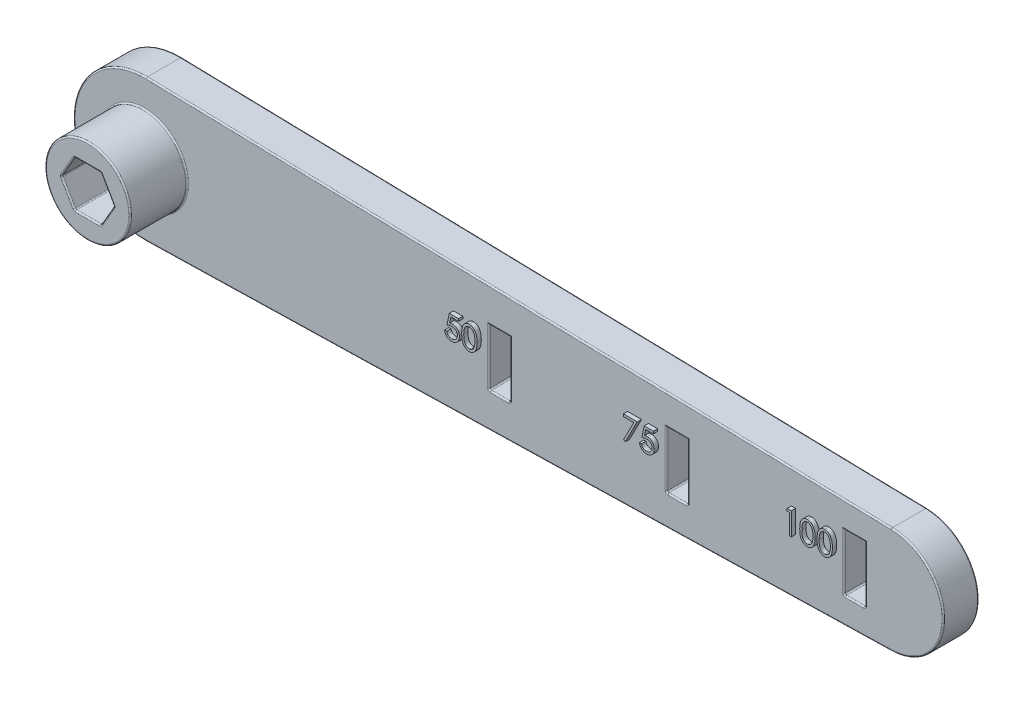
from build123d import *

# Parameters (mm, degrees)
BOSS_EXTRUDE1_DEPTH = 5
CUT_EXTRUDE2_REACH  = 115.054
CUT_EXTRUDE3_REACH  = 115.054
SKETCH4_W           = 3
SKETCH4_H           = 8
SKETCH6_R           = 6
BOSS_EXTRUDE3_DEPTH = 8
FILLET1_R           = 0.2
BOSS_EXTRUDE2_DEPTH = 0.6


with BuildPart() as part:
    # Sketch3 → Boss-Extrude1 (new body)
    with BuildSketch(Plane.XY):
        with BuildLine():
            Line((0.238095238, 9.997165131), (105.178571429, 7.497873848))
            ThreePointArc((105.178571429, 7.497873848), (112.5, 0), (105.178571429, -7.497873848))
            Line((105.178571429, -7.497873848), (0.238095238, -9.997165131))
            ThreePointArc((0.238095238, -9.997165131), (-10, 0), (0.238095238, 9.997165131))
        make_face()
    extrude(amount=BOSS_EXTRUDE1_DEPTH)

    # Sketch2 → Cut-Extrude2 (cut, up to next)
    with BuildSketch(Plane.XY, mode=Mode.PRIVATE) as cut_extrude2_sk1:
        Polygon((3.695041723, 0), (1.847520861, 3.2), (-1.847520861, 3.2), (-3.695041723, 0), (-1.847520861, -3.2), (1.847520861, -3.2), align=None)
    cut_extrude2_tool1 = extrude(cut_extrude2_sk1.sketch, amount=CUT_EXTRUDE2_REACH, mode=Mode.PRIVATE) & part.part
    add(cut_extrude2_tool1.solids().sort_by_distance((0, 0, 0))[0], mode=Mode.SUBTRACT)

    # Sketch4 → Cut-Extrude3 (cut, up to next)
    with BuildSketch(Plane.XY.offset(5), mode=Mode.PRIVATE) as cut_extrude3_sk1:
        with Locations((100, 0)):
            Rectangle(SKETCH4_W, SKETCH4_H)
    cut_extrude3_tool1 = extrude(cut_extrude3_sk1.sketch, amount=-CUT_EXTRUDE3_REACH, mode=Mode.PRIVATE) & part.part
    # Sketch4 → Cut-Extrude3 (cut, up to next)
    with BuildSketch(Plane.XY.offset(5), mode=Mode.PRIVATE) as cut_extrude3_sk2:
        with Locations((75, 0)):
            Rectangle(SKETCH4_W, SKETCH4_H)
    cut_extrude3_tool2 = extrude(cut_extrude3_sk2.sketch, amount=-CUT_EXTRUDE3_REACH, mode=Mode.PRIVATE) & part.part
    # Sketch4 → Cut-Extrude3 (cut, up to next)
    with BuildSketch(Plane.XY.offset(5), mode=Mode.PRIVATE) as cut_extrude3_sk3:
        with Locations((50, 0)):
            Rectangle(SKETCH4_W, SKETCH4_H)
    cut_extrude3_tool3 = extrude(cut_extrude3_sk3.sketch, amount=-CUT_EXTRUDE3_REACH, mode=Mode.PRIVATE) & part.part
    add(cut_extrude3_tool1.solids().sort_by_distance((100, 0, 5))[0], mode=Mode.SUBTRACT)
    add(cut_extrude3_tool2.solids().sort_by_distance((75, 0, 5))[0], mode=Mode.SUBTRACT)
    add(cut_extrude3_tool3.solids().sort_by_distance((50, 0, 5))[0], mode=Mode.SUBTRACT)

    # Sketch6 → Boss-Extrude3 (add)
    with BuildSketch(Plane.XY.offset(5)):
        Circle(SKETCH6_R)
        Polygon((3.695041723, 0), (1.847520861, 3.2), (-1.847520861, 3.2), (-3.695041723, 0), (-1.847520861, -3.2), (1.847520861, -3.2), align=None, mode=Mode.SUBTRACT)
    extrude(amount=BOSS_EXTRUDE3_DEPTH)

    # Fillet1
    fillet1_edges = [part.edges().sort_by_distance(p)[0] for p in [
        (51.5, -4, 2.5),
        (48.5, -4, 2.5),
        (101.5, -4, 2.5),
        (98.5, -4, 2.5),
        (76.5, -4, 2.5),
        (73.5, -4, 2.5),
        (76.5, 0, 0),
        (75, -4, 0),
        (73.5, 0, 0),
        (52.708333333, 8.74751949, 0),
        (51.5, 0, 0),
        (50, -4, 0),
        (48.5, 0, 0),
        (-10, 0, 0),
        (52.708333333, -8.74751949, 0),
        (112.5, 0, 0),
        (101.5, 0, 0),
        (100, -4, 0),
        (98.5, 0, 0),
        (100, -4, 5),
        (101.5, 0, 5),
        (52.708333333, 8.74751949, 5),
        (112.5, 0, 5),
        (52.708333333, -8.74751949, 5),
        (-10, 0, 5),
        (48.5, 0, 5),
        (50, -4, 5),
        (51.5, 0, 5),
        (73.5, 0, 5),
        (75, -4, 5),
        (76.5, 0, 5),
        (98.5, 0, 5),
        (-6, 0, 5),
        (-6, 0, 13),
        (50, 4, 0),
        (75, 4, 0),
        (100, 4, 0),
        (100, 4, 5),
        (75, 4, 5),
        (50, 4, 5),
        (0, -3.2, 0),
        (-2.771281292, -1.6, 0),
        (-2.771281292, 1.6, 0),
        (0, 3.2, 0),
        (2.771281292, 1.6, 0),
        (2.771281292, -1.6, 0),
        (2.771281292, 1.6, 13),
        (0, -3.2, 13),
        (-2.771281292, 1.6, 13),
        (3.695041723, 0, 6.5),
        (2.771281292, -1.6, 13),
        (1.847520861, -3.2, 6.5),
        (-1.847520861, 3.2, 6.5),
        (0, 3.2, 13),
        (1.847520861, 3.2, 6.5),
        (-1.847520861, -3.2, 6.5),
        (-2.771281292, -1.6, 13),
        (-3.695041723, 0, 6.5),
    ]]
    fillet(fillet1_edges, radius=FILLET1_R)

    # Sketch5 → Boss-Extrude2 (add)
    # profile 1 of 7: a face of its own
    with BuildSketch(Plane.XY.offset(5)):
        with BuildLine():
            Line((44.816666667, 3.175), (44.816666667, 2.849358974))
            Line((44.816666667, 2.849358974), (43.736708734, 2.849358974))
            Line((43.736708734, 2.849358974), (43.565619992, 2.014267829))
            add(Edge.make_bspline(
                [(43.565619992, 2.014267829), (43.599234964, 2.023548147), (43.664358655, 2.041527295), (43.760479386, 2.061489672), (43.851730885, 2.073523325), (43.910944971, 2.075166443), (43.939598357, 2.075961538)],
                knots=[0, 0, 0, 0, 1.100273476, 2.13160584, 3.095893838, 4, 4, 4, 4], degree=3))
            add(Edge.make_bspline(
                [(43.939598357, 2.075961538), (43.975052893, 2.075194154), (44.044765367, 2.073685284), (44.146763555, 2.059196535), (44.244129822, 2.036391041), (44.336660544, 2.004531711), (44.424526901, 1.963792167), (44.506920474, 1.912901507), (44.58507801, 1.853453414), (44.657597363, 1.785104724), (44.723387271, 1.709882972), (44.781232133, 1.629004046), (44.83036534, 1.543253952), (44.869881167, 1.4518134), (44.901435528, 1.355693311), (44.922437695, 1.253882325), (44.936422852, 1.147340102), (44.937985302, 1.074492385), (44.938782051, 1.037344752)],
                knots=[0, 0, 0, 0, 1.052922333, 2.070308379, 3.05430497, 4.020497103, 4.973039431, 5.925935799, 6.892292201, 7.88610001, 8.88166317, 9.857072816, 10.836096531, 11.812156883, 12.81219415, 13.836441305, 14.89672472, 16, 16, 16, 16], degree=3))
            add(Edge.make_bspline(
                [(44.938782051, 1.037344752), (44.938178733, 1.011471023), (44.93698025, 0.960073227), (44.930885531, 0.883742417), (44.919150989, 0.809027561), (44.903395982, 0.735918748), (44.882946788, 0.664554389), (44.858191718, 0.594730218), (44.82789675, 0.526880824), (44.79466686, 0.460364216), (44.757250412, 0.396684142), (44.715722766, 0.337131132), (44.671848356, 0.28081182), (44.624639385, 0.228330219), (44.573657054, 0.180031196), (44.519518798, 0.135628112), (44.462656617, 0.094370048), (44.40219079, 0.057931757), (44.339468681, 0.024401075), (44.273584512, -0.003106705), (44.20603802, -0.027699827), (44.135857025, -0.047302756), (44.063200495, -0.062663002), (43.987948663, -0.073095689), (43.910496198, -0.080694315), (43.857995294, -0.081169982), (43.831475361, -0.081410256)],
                knots=[0, 0, 0, 0, 1.056347294, 2.098418968, 3.122841568, 4.141288669, 5.149314143, 6.15115421, 7.162517403, 8.180376062, 9.185164535, 10.17417709, 11.141909838, 12.097768115, 13.052685741, 14.0056014, 14.954263652, 15.917497458, 16.885230207, 17.854509472, 18.828990115, 19.81800267, 20.826176721, 21.857883937, 22.917946725, 24, 24, 24, 24], degree=3))
            add(Edge.make_bspline(
                [(43.831475361, -0.081410256), (43.799839497, -0.080783568), (43.737599672, -0.079550632), (43.646413157, -0.066652434), (43.558679194, -0.048179453), (43.47510403, -0.02038798), (43.39493867, 0.014434781), (43.319262347, 0.058445879), (43.246141393, 0.10831978), (43.178548331, 0.167175529), (43.115813857, 0.231506183), (43.05965581, 0.301317758), (43.009641779, 0.375458038), (42.96657268, 0.454287077), (42.929835189, 0.537597745), (42.90097445, 0.625702181), (42.877680514, 0.718140042), (42.867825839, 0.781779298), (42.862820513, 0.814102564)],
                knots=[0, 0, 0, 0, 1.0467383, 2.05933395, 3.04377827, 4.011590433, 4.970194871, 5.932262533, 6.905835911, 7.896367577, 8.894135286, 9.877477877, 10.858688626, 11.851381753, 12.8477658, 13.868841284, 14.917554742, 16, 16, 16, 16], degree=3))
            Line((42.862820513, 0.814102564), (43.14775641, 0.814102564))
            add(Edge.make_bspline(
                [(43.14775641, 0.814102564), (43.154767316, 0.783825354), (43.168242666, 0.725630874), (43.197820738, 0.643868872), (43.233984782, 0.571007861), (43.276987298, 0.506084025), (43.328286254, 0.449470149), (43.386823665, 0.399017529), (43.452453385, 0.353501518), (43.525381529, 0.315562294), (43.602319108, 0.283205639), (43.682843649, 0.261659459), (43.764762592, 0.246509363), (43.820169399, 0.244992837), (43.848011819, 0.244230769)],
                knots=[0, 0, 0, 0, 1.136247022, 2.183929868, 3.172523383, 4.106158343, 5.02341133, 5.958108904, 6.928429099, 7.938127109, 8.96079061, 9.975095812, 10.982467395, 12, 12, 12, 12], degree=3))
            add(Edge.make_bspline(
                [(43.848011819, 0.244230769), (43.875188408, 0.244975332), (43.928699334, 0.246441382), (44.007449663, 0.257725343), (44.083479913, 0.275103997), (44.156039872, 0.301111651), (44.226399269, 0.332720789), (44.292778332, 0.37328375), (44.357097371, 0.419965339), (44.417357178, 0.473447424), (44.472547249, 0.532384219), (44.521311731, 0.59541014), (44.561930788, 0.662644708), (44.596161015, 0.732923925), (44.622153651, 0.807018045), (44.640696541, 0.884579825), (44.65158503, 0.965800843), (44.653082886, 1.021199431), (44.653846154, 1.049429087)],
                knots=[0, 0, 0, 0, 1.027316725, 2.022795036, 3.002884548, 3.971462791, 4.93288096, 5.914575861, 6.907176829, 7.935150275, 8.956128384, 9.956726525, 10.942570165, 11.921478529, 12.907843606, 13.90538589, 14.932640048, 16, 16, 16, 16], degree=3))
            add(Edge.make_bspline(
                [(44.653846154, 1.049429087), (44.653248819, 1.074897804), (44.652079621, 1.124749195), (44.642526889, 1.197682761), (44.625910778, 1.266691878), (44.602847687, 1.33210979), (44.573565563, 1.393998198), (44.537782122, 1.452420974), (44.494825825, 1.506608094), (44.445756755, 1.556584911), (44.392001246, 1.602708476), (44.332634423, 1.642027754), (44.268898632, 1.675105737), (44.201561781, 1.703651707), (44.129022195, 1.724153812), (44.052716392, 1.739546108), (43.971820379, 1.748450044), (43.916511254, 1.749685471), (43.888080929, 1.750320513)],
                knots=[0, 0, 0, 0, 1.045622112, 2.046656509, 3.013763289, 3.955457236, 4.890082067, 5.820317437, 6.762574623, 7.722996705, 8.69280354, 9.665887285, 10.63943826, 11.638615906, 12.663482002, 13.728887084, 14.832589034, 16, 16, 16, 16], degree=3))
            add(Edge.make_bspline(
                [(43.888080929, 1.750320513), (43.863471115, 1.749793834), (43.812658093, 1.748706375), (43.734713815, 1.740699481), (43.652806323, 1.727782407), (43.567249602, 1.710014883), (43.477786713, 1.686763834), (43.384606449, 1.658901395), (43.287512893, 1.625589296), (43.222091814, 1.600432216), (43.188461538, 1.5875)],
                knots=[0, 0, 0, 0, 0.817624296, 1.688186739, 2.600797293, 3.572016777, 4.590301741, 5.671205678, 6.80286297, 8, 8, 8, 8], degree=3))
            Line((43.188461538, 1.5875), (43.514102564, 3.175))
            Line((43.514102564, 3.175), (44.816666667, 3.175))
        make_face()
    # profile 2 of 7: a face of its own
    with BuildSketch(Plane.XY.offset(5)):
        with BuildLine():
            add(Edge.make_bspline(
                [(45.264423077, 1.586227965), (45.264720636, 1.637116309), (45.26529865, 1.735967652), (45.27172886, 1.880008006), (45.282410778, 2.015136268), (45.29704968, 2.141358907), (45.314864134, 2.258708507), (45.338645325, 2.366871466), (45.365689796, 2.466348394), (45.3970338, 2.557463681), (45.432401295, 2.641444883), (45.470895231, 2.719844887), (45.514043295, 2.792545069), (45.559379494, 2.860705779), (45.608739016, 2.923211273), (45.660717205, 2.98094426), (45.717342764, 3.032570441), (45.776690779, 3.079602444), (45.839298571, 3.120831607), (45.903381561, 3.15714702), (45.969380836, 3.188171185), (46.037476588, 3.212564652), (46.107056765, 3.232713063), (46.178364604, 3.246491609), (46.251517842, 3.25516109), (46.300894929, 3.255989917), (46.325936498, 3.256410256)],
                knots=[0, 0, 0, 0, 1.646270934, 3.197905019, 4.663502075, 6.030701355, 7.308322542, 8.50163776, 9.611534131, 10.641858119, 11.616356847, 12.558055219, 13.465016945, 14.349605745, 15.204443733, 16.039544428, 16.859896111, 17.680448484, 18.487036065, 19.28249412, 20.06191084, 20.843045899, 21.620316918, 22.403196591, 23.190181807, 24, 24, 24, 24], degree=3))
            add(Edge.make_bspline(
                [(46.325936498, 3.256410256), (46.351187254, 3.255967738), (46.401403062, 3.255087709), (46.475643974, 3.246629561), (46.548169756, 3.232595043), (46.618671211, 3.212709587), (46.687727449, 3.188039223), (46.754798333, 3.157117338), (46.820300471, 3.121122937), (46.883192946, 3.07882842), (46.944166204, 3.031673069), (47.001722571, 2.978366934), (47.055867284, 2.91944826), (47.107279883, 2.855547427), (47.154501746, 2.785438814), (47.199471931, 2.7103418), (47.239723706, 2.628943087), (47.278490162, 2.542600805), (47.311951928, 2.448925915), (47.342129165, 2.348446454), (47.366512229, 2.239975584), (47.386822498, 2.124082419), (47.402556796, 2.000341345), (47.414016407, 1.869017616), (47.420069849, 1.730024833), (47.421209856, 1.634994498), (47.421794872, 1.586227965)],
                knots=[0, 0, 0, 0, 0.810914788, 1.612654377, 2.396697861, 3.181598691, 3.963628158, 4.749916497, 5.551656086, 6.361998678, 7.18212741, 8.025565596, 8.878627764, 9.750805457, 10.657531673, 11.591944965, 12.560506719, 13.57287815, 14.630710178, 15.753379473, 16.941251878, 18.199788006, 19.531962791, 20.947069417, 22.433333509, 24, 24, 24, 24], degree=3))
            add(Edge.make_bspline(
                [(47.421794872, 1.586227965), (47.421203792, 1.537674134), (47.420052096, 1.443068975), (47.414084269, 1.30470159), (47.402328939, 1.174074794), (47.387624164, 1.050875303), (47.367257933, 0.935615891), (47.342216104, 0.827897713), (47.314411883, 0.727255591), (47.280090319, 0.634514012), (47.242524889, 0.548379235), (47.20165339, 0.467945464), (47.157865762, 0.392501756), (47.110160258, 0.322651986), (47.059311804, 0.257901347), (47.004232096, 0.199392789), (46.946473779, 0.145716537), (46.885321088, 0.097953989), (46.821447752, 0.056148487), (46.756170589, 0.018761637), (46.688331377, -0.011385165), (46.619467484, -0.037270523), (46.548593895, -0.057046647), (46.475798955, -0.070720788), (46.401452941, -0.080310965), (46.351195807, -0.081042557), (46.325936498, -0.081410256)],
                knots=[0, 0, 0, 0, 1.561518951, 3.042555995, 4.452378317, 5.7783523, 7.031515105, 8.214008947, 9.334062868, 10.386615937, 11.391082383, 12.354592575, 13.286541444, 14.194233754, 15.072674879, 15.931287219, 16.775624067, 17.606195743, 18.42308326, 19.229000347, 20.022332153, 20.807536673, 21.593273796, 22.3848459, 23.188221202, 24, 24, 24, 24], degree=3))
            add(Edge.make_bspline(
                [(46.325936498, -0.081410256), (46.300895624, -0.080987205), (46.251519906, -0.080153031), (46.178356634, -0.071522718), (46.107343275, -0.057647511), (46.038129405, -0.038219592), (45.970359924, -0.01443899), (45.904958292, 0.01654328), (45.841197322, 0.052224899), (45.779247125, 0.092860746), (45.720271807, 0.139416844), (45.663939501, 0.190910163), (45.611665377, 0.248625686), (45.56301159, 0.311652088), (45.51677081, 0.379409529), (45.47423545, 0.452823125), (45.434891889, 0.531601779), (45.39892958, 0.616254455), (45.367044721, 0.708016425), (45.338880014, 0.807937466), (45.316642171, 0.916899507), (45.297607633, 1.034027404), (45.2822548, 1.15982447), (45.271773376, 1.294358997), (45.265295184, 1.437547151), (45.264719084, 1.535763303), (45.264423077, 1.586227965)],
                knots=[0, 0, 0, 0, 0.810891512, 1.598919785, 2.382837074, 3.152667961, 3.926044502, 4.706494248, 5.493654104, 6.291793342, 7.103789334, 7.925228297, 8.761435821, 9.622817696, 10.50288917, 11.416980706, 12.369136599, 13.353924996, 14.394355917, 15.514179734, 16.714354668, 17.994756427, 19.357759367, 20.818452758, 22.365282078, 24, 24, 24, 24], degree=3))
        make_face()
        with BuildLine():
            add(Edge.make_bspline(
                [(45.549358974, 1.5875), (45.54946733, 1.545092252), (45.549677627, 1.46278714), (45.555171466, 1.343186467), (45.562655605, 1.231634812), (45.572308782, 1.127990532), (45.586644313, 1.03260445), (45.6027069, 0.944820523), (45.622254095, 0.865103315), (45.645381719, 0.792905801), (45.671724328, 0.727002717), (45.700486076, 0.665678758), (45.731384017, 0.608209501), (45.765963532, 0.555111156), (45.803623625, 0.506210565), (45.843513653, 0.46064221), (45.887122355, 0.420004948), (45.94745075, 0.371267015), (46.027094694, 0.32090323), (46.12744325, 0.27704642), (46.230556774, 0.249485191), (46.300543979, 0.245980213), (46.335476763, 0.244230769)],
                knots=[0, 0, 0, 0, 1.459021318, 2.831673884, 4.118529203, 5.306027144, 6.411944654, 7.436330062, 8.375795394, 9.233974572, 10.042671642, 10.816086306, 11.563610507, 12.285937304, 12.993564865, 13.685989202, 14.367179055, 15.041617293, 16.353048772, 17.594441528, 18.799311195, 20, 20, 20, 20], degree=3))
            add(Edge.make_bspline(
                [(46.335476763, 0.244230769), (46.370635508, 0.245680185), (46.440880408, 0.248576023), (46.543508922, 0.276514878), (46.643140667, 0.318669388), (46.721220213, 0.368514626), (46.780622235, 0.415983896), (46.823182647, 0.456455755), (46.862246077, 0.501772864), (46.899295673, 0.550667225), (46.933276406, 0.604072978), (46.964176538, 0.661733315), (46.992373575, 0.723808354), (47.00843821, 0.767142332), (47.016651643, 0.789297877)],
                knots=[0, 0, 0, 0, 1.353760809, 2.704726607, 4.075137775, 5.516104923, 6.260822281, 7.007110065, 7.778089737, 8.566572457, 9.372053459, 10.217411131, 11.088608312, 12, 12, 12, 12], degree=3))
            add(Edge.make_bspline(
                [(47.016651643, 0.789297877), (47.026223603, 0.817627712), (47.045658789, 0.875149426), (47.070706613, 0.964379311), (47.090432796, 1.057998961), (47.108179564, 1.155448888), (47.120292693, 1.25744776), (47.130042495, 1.36367998), (47.135785332, 1.474225644), (47.136497214, 1.549332529), (47.136858974, 1.5875)],
                knots=[0, 0, 0, 0, 0.884706709, 1.796334032, 2.740027952, 3.714592787, 4.726048262, 5.777819803, 6.87074269, 8, 8, 8, 8], degree=3))
            add(Edge.make_bspline(
                [(47.136858974, 1.5875), (47.136359874, 1.625661298), (47.135383527, 1.700312955), (47.131651553, 1.809640161), (47.122014453, 1.913478773), (47.111310967, 2.01227613), (47.095529202, 2.105485333), (47.078513191, 2.193886682), (47.055652092, 2.276384997), (47.03123201, 2.354271903), (47.00328258, 2.426662497), (46.972516164, 2.493894289), (46.939657854, 2.556291861), (46.903968822, 2.613684015), (46.865872738, 2.666327822), (46.824364104, 2.713167775), (46.781089423, 2.755655596), (46.72047669, 2.804153784), (46.641125013, 2.853603679), (46.542386461, 2.89911119), (46.439633805, 2.925244427), (46.370170743, 2.928928957), (46.335476763, 2.930769231)],
                knots=[0, 0, 0, 0, 1.31362396, 2.569729283, 3.763502607, 4.902122613, 5.988968491, 7.01645872, 7.998833611, 8.933434873, 9.825090667, 10.667526885, 11.477055099, 12.250526234, 12.991942729, 13.710640831, 14.402115721, 15.076753259, 16.378508321, 17.609869233, 18.806226677, 20, 20, 20, 20], degree=3))
            add(Edge.make_bspline(
                [(46.335476763, 2.930769231), (46.300360726, 2.928926418), (46.230064678, 2.925237437), (46.126244034, 2.899208557), (46.026726515, 2.853839652), (45.947584674, 2.80399), (45.886929667, 2.756511674), (45.844218938, 2.715339677), (45.804172053, 2.670303432), (45.76728064, 2.620953123), (45.732728219, 2.567916683), (45.700995443, 2.510776875), (45.672404722, 2.449244137), (45.646020893, 2.383370657), (45.622822721, 2.311179371), (45.603687483, 2.231560356), (45.586009942, 2.144055639), (45.573495662, 2.048152943), (45.562370684, 1.944482704), (45.555221175, 1.832652565), (45.549659249, 1.712851306), (45.549461071, 1.630120641), (45.549358974, 1.5875)],
                knots=[0, 0, 0, 0, 1.207732386, 2.417664972, 3.655092373, 4.956220595, 5.625982001, 6.301752483, 6.994047911, 7.697131622, 8.419323945, 9.170223765, 9.943494443, 10.752040957, 11.610060368, 12.549350801, 13.567764191, 14.679664412, 15.874934091, 17.154273443, 18.533957287, 20, 20, 20, 20], degree=3))
        make_face(mode=Mode.SUBTRACT)
    # profile 3 of 7: a face of its own
    with BuildSketch(Plane.XY.offset(5)):
        Polygon((68.025641026, 3.175), (69.979487179, 3.175), (68.310576923, -0.081410256), (68.064438101, 0.054061498), (69.497385817, 2.849358974), (68.025641026, 2.849358974), align=None)
    # profile 4 of 7: a face of its own
    with BuildSketch(Plane.XY.offset(5)):
        with BuildLine():
            Line((72.258974359, 3.175), (72.258974359, 2.849358974))
            Line((72.258974359, 2.849358974), (71.179016426, 2.849358974))
            Line((71.179016426, 2.849358974), (71.007927684, 2.014267829))
            add(Edge.make_bspline(
                [(71.007927684, 2.014267829), (71.041542656, 2.023548147), (71.106666347, 2.041527295), (71.202787078, 2.061489672), (71.294038577, 2.073523325), (71.353252663, 2.075166443), (71.38190605, 2.075961538)],
                knots=[0, 0, 0, 0, 1.100273476, 2.13160584, 3.095893838, 4, 4, 4, 4], degree=3))
            add(Edge.make_bspline(
                [(71.38190605, 2.075961538), (71.417360585, 2.075194154), (71.48707306, 2.073685284), (71.589071247, 2.059196535), (71.686437515, 2.036391041), (71.778968236, 2.004531711), (71.866834593, 1.963792167), (71.949228167, 1.912901507), (72.027385702, 1.853453414), (72.099905055, 1.785104724), (72.165694963, 1.709882972), (72.223539825, 1.629004046), (72.272673032, 1.543253952), (72.31218886, 1.4518134), (72.34374322, 1.355693311), (72.364745387, 1.253882325), (72.378730544, 1.147340102), (72.380292995, 1.074492385), (72.381089744, 1.037344752)],
                knots=[0, 0, 0, 0, 1.052922333, 2.070308379, 3.05430497, 4.020497103, 4.973039431, 5.925935799, 6.892292201, 7.88610001, 8.88166317, 9.857072816, 10.836096531, 11.812156883, 12.81219415, 13.836441305, 14.89672472, 16, 16, 16, 16], degree=3))
            add(Edge.make_bspline(
                [(72.381089744, 1.037344752), (72.380486425, 1.011471023), (72.379287942, 0.960073227), (72.373193223, 0.883742417), (72.361458681, 0.809027561), (72.345703674, 0.735918748), (72.325254481, 0.664554389), (72.30049941, 0.594730218), (72.270204442, 0.526880824), (72.236974552, 0.460364216), (72.199558104, 0.396684142), (72.158030458, 0.337131132), (72.114156048, 0.28081182), (72.066947077, 0.228330219), (72.015964746, 0.180031196), (71.96182649, 0.135628112), (71.904964309, 0.094370048), (71.844498482, 0.057931757), (71.781776373, 0.024401075), (71.715892204, -0.003106705), (71.648345712, -0.027699827), (71.578164718, -0.047302756), (71.505508188, -0.062663002), (71.430256356, -0.073095689), (71.352803891, -0.080694315), (71.300302986, -0.081169982), (71.273783053, -0.081410256)],
                knots=[0, 0, 0, 0, 1.056347294, 2.098418968, 3.122841568, 4.141288669, 5.149314143, 6.15115421, 7.162517403, 8.180376062, 9.185164535, 10.17417709, 11.141909838, 12.097768115, 13.052685741, 14.0056014, 14.954263652, 15.917497458, 16.885230207, 17.854509472, 18.828990115, 19.81800267, 20.826176721, 21.857883937, 22.917946725, 24, 24, 24, 24], degree=3))
            add(Edge.make_bspline(
                [(71.273783053, -0.081410256), (71.242147189, -0.080783568), (71.179907364, -0.079550632), (71.08872085, -0.066652434), (71.000986886, -0.048179453), (70.917411723, -0.02038798), (70.837246362, 0.014434781), (70.761570039, 0.058445879), (70.688449085, 0.10831978), (70.620856024, 0.167175529), (70.558121549, 0.231506183), (70.501963502, 0.301317758), (70.451949471, 0.375458038), (70.408880372, 0.454287077), (70.372142882, 0.537597745), (70.343282142, 0.625702181), (70.319988206, 0.718140042), (70.310133532, 0.781779298), (70.305128205, 0.814102564)],
                knots=[0, 0, 0, 0, 1.0467383, 2.05933395, 3.04377827, 4.011590433, 4.970194871, 5.932262533, 6.905835911, 7.896367577, 8.894135286, 9.877477877, 10.858688626, 11.851381753, 12.8477658, 13.868841284, 14.917554742, 16, 16, 16, 16], degree=3))
            Line((70.305128205, 0.814102564), (70.590064103, 0.814102564))
            add(Edge.make_bspline(
                [(70.590064103, 0.814102564), (70.597075008, 0.783825354), (70.610550358, 0.725630874), (70.64012843, 0.643868872), (70.676292474, 0.571007861), (70.71929499, 0.506084025), (70.770593947, 0.449470149), (70.829131357, 0.399017529), (70.894761078, 0.353501518), (70.967689221, 0.315562294), (71.044626801, 0.283205639), (71.125151341, 0.261659459), (71.207070284, 0.246509363), (71.262477091, 0.244992837), (71.290319511, 0.244230769)],
                knots=[0, 0, 0, 0, 1.136247022, 2.183929868, 3.172523383, 4.106158343, 5.02341133, 5.958108904, 6.928429099, 7.938127109, 8.96079061, 9.975095812, 10.982467395, 12, 12, 12, 12], degree=3))
            add(Edge.make_bspline(
                [(71.290319511, 0.244230769), (71.3174961, 0.244975332), (71.371007026, 0.246441382), (71.449757355, 0.257725343), (71.525787605, 0.275103997), (71.598347565, 0.301111651), (71.668706961, 0.332720789), (71.735086025, 0.37328375), (71.799405063, 0.419965339), (71.85966487, 0.473447424), (71.914854942, 0.532384219), (71.963619423, 0.59541014), (72.00423848, 0.662644708), (72.038468708, 0.732923925), (72.064461343, 0.807018045), (72.083004233, 0.884579825), (72.093892722, 0.965800843), (72.095390578, 1.021199431), (72.096153846, 1.049429087)],
                knots=[0, 0, 0, 0, 1.027316725, 2.022795036, 3.002884548, 3.971462791, 4.93288096, 5.914575861, 6.907176829, 7.935150275, 8.956128384, 9.956726525, 10.942570165, 11.921478529, 12.907843606, 13.90538589, 14.932640048, 16, 16, 16, 16], degree=3))
            add(Edge.make_bspline(
                [(72.096153846, 1.049429087), (72.095556511, 1.074897804), (72.094387313, 1.124749195), (72.084834581, 1.197682761), (72.068218471, 1.266691878), (72.04515538, 1.33210979), (72.015873255, 1.393998198), (71.980089814, 1.452420974), (71.937133518, 1.506608094), (71.888064447, 1.556584911), (71.834308939, 1.602708476), (71.774942115, 1.642027754), (71.711206324, 1.675105737), (71.643869473, 1.703651707), (71.571329887, 1.724153812), (71.495024085, 1.739546108), (71.414128071, 1.748450044), (71.358818947, 1.749685471), (71.330388622, 1.750320513)],
                knots=[0, 0, 0, 0, 1.045622112, 2.046656509, 3.013763289, 3.955457236, 4.890082067, 5.820317437, 6.762574623, 7.722996705, 8.69280354, 9.665887285, 10.63943826, 11.638615906, 12.663482002, 13.728887084, 14.832589034, 16, 16, 16, 16], degree=3))
            add(Edge.make_bspline(
                [(71.330388622, 1.750320513), (71.305778808, 1.749793834), (71.254965785, 1.748706375), (71.177021507, 1.740699481), (71.095114015, 1.727782407), (71.009557294, 1.710014883), (70.920094405, 1.686763834), (70.826914141, 1.658901395), (70.729820585, 1.625589296), (70.664399507, 1.600432216), (70.630769231, 1.5875)],
                knots=[0, 0, 0, 0, 0.817624296, 1.688186739, 2.600797293, 3.572016777, 4.590301741, 5.671205678, 6.80286297, 8, 8, 8, 8], degree=3))
            Line((70.630769231, 1.5875), (70.956410256, 3.175))
            Line((70.956410256, 3.175), (72.258974359, 3.175))
        make_face()
    # profile 5 of 7: a face of its own
    with BuildSketch(Plane.XY.offset(5)):
        Polygon((91.096930088, 3.175), (91.683974359, 3.175), (91.683974359, 0), (91.399038462, 0), (91.399038462, 2.849358974), (90.910576923, 2.849358974), align=None)
    # profile 6 of 7: a face of its own
    with BuildSketch(Plane.XY.offset(5)):
        with BuildLine():
            add(Edge.make_bspline(
                [(92.864423077, 1.586227965), (92.864720636, 1.637116309), (92.86529865, 1.735967652), (92.87172886, 1.880008006), (92.882410778, 2.015136268), (92.89704968, 2.141358907), (92.914864134, 2.258708507), (92.938645325, 2.366871466), (92.965689796, 2.466348394), (92.9970338, 2.557463681), (93.032401295, 2.641444883), (93.070895231, 2.719844887), (93.114043295, 2.792545069), (93.159379494, 2.860705779), (93.208739016, 2.923211273), (93.260717205, 2.98094426), (93.317342764, 3.032570441), (93.376690779, 3.079602444), (93.439298571, 3.120831607), (93.503381561, 3.15714702), (93.569380836, 3.188171185), (93.637476588, 3.212564652), (93.707056765, 3.232713063), (93.778364604, 3.246491609), (93.851517842, 3.25516109), (93.900894929, 3.255989917), (93.925936498, 3.256410256)],
                knots=[0, 0, 0, 0, 1.646270934, 3.197905019, 4.663502075, 6.030701355, 7.308322542, 8.50163776, 9.611534131, 10.641858119, 11.616356847, 12.558055219, 13.465016945, 14.349605745, 15.204443733, 16.039544428, 16.859896111, 17.680448484, 18.487036065, 19.28249412, 20.06191084, 20.843045899, 21.620316918, 22.403196591, 23.190181807, 24, 24, 24, 24], degree=3))
            add(Edge.make_bspline(
                [(93.925936498, 3.256410256), (93.951187254, 3.255967738), (94.001403062, 3.255087709), (94.075643974, 3.246629561), (94.148169756, 3.232595043), (94.218671211, 3.212709587), (94.287727449, 3.188039223), (94.354798333, 3.157117338), (94.420300471, 3.121122937), (94.483192946, 3.07882842), (94.544166204, 3.031673069), (94.601722571, 2.978366934), (94.655867284, 2.91944826), (94.707279883, 2.855547427), (94.754501746, 2.785438814), (94.799471931, 2.7103418), (94.839723706, 2.628943087), (94.878490162, 2.542600805), (94.911951928, 2.448925915), (94.942129165, 2.348446454), (94.966512229, 2.239975584), (94.986822498, 2.124082419), (95.002556796, 2.000341345), (95.014016407, 1.869017616), (95.020069849, 1.730024833), (95.021209856, 1.634994498), (95.021794872, 1.586227965)],
                knots=[0, 0, 0, 0, 0.810914788, 1.612654377, 2.396697861, 3.181598691, 3.963628158, 4.749916497, 5.551656086, 6.361998678, 7.18212741, 8.025565596, 8.878627764, 9.750805457, 10.657531673, 11.591944965, 12.560506719, 13.57287815, 14.630710178, 15.753379473, 16.941251878, 18.199788006, 19.531962791, 20.947069417, 22.433333509, 24, 24, 24, 24], degree=3))
            add(Edge.make_bspline(
                [(95.021794872, 1.586227965), (95.021203792, 1.537674134), (95.020052096, 1.443068975), (95.014084269, 1.30470159), (95.002328939, 1.174074794), (94.987624164, 1.050875303), (94.967257933, 0.935615891), (94.942216104, 0.827897713), (94.914411883, 0.727255591), (94.880090319, 0.634514012), (94.842524889, 0.548379235), (94.80165339, 0.467945464), (94.757865762, 0.392501756), (94.710160258, 0.322651986), (94.659311804, 0.257901347), (94.604232096, 0.199392789), (94.546473779, 0.145716537), (94.485321088, 0.097953989), (94.421447752, 0.056148487), (94.356170589, 0.018761637), (94.288331377, -0.011385165), (94.219467484, -0.037270523), (94.148593895, -0.057046647), (94.075798955, -0.070720788), (94.001452941, -0.080310965), (93.951195807, -0.081042557), (93.925936498, -0.081410256)],
                knots=[0, 0, 0, 0, 1.561518951, 3.042555995, 4.452378317, 5.7783523, 7.031515105, 8.214008947, 9.334062868, 10.386615937, 11.391082383, 12.354592575, 13.286541444, 14.194233754, 15.072674879, 15.931287219, 16.775624067, 17.606195743, 18.42308326, 19.229000347, 20.022332153, 20.807536673, 21.593273796, 22.3848459, 23.188221202, 24, 24, 24, 24], degree=3))
            add(Edge.make_bspline(
                [(93.925936498, -0.081410256), (93.900895624, -0.080987205), (93.851519906, -0.080153031), (93.778356634, -0.071522718), (93.707343275, -0.057647511), (93.638129405, -0.038219592), (93.570359924, -0.01443899), (93.504958292, 0.01654328), (93.441197322, 0.052224899), (93.379247125, 0.092860746), (93.320271807, 0.139416844), (93.263939501, 0.190910163), (93.211665377, 0.248625686), (93.16301159, 0.311652088), (93.11677081, 0.379409529), (93.07423545, 0.452823125), (93.034891889, 0.531601779), (92.99892958, 0.616254455), (92.967044721, 0.708016425), (92.938880014, 0.807937466), (92.916642171, 0.916899507), (92.897607633, 1.034027404), (92.8822548, 1.15982447), (92.871773376, 1.294358997), (92.865295184, 1.437547151), (92.864719084, 1.535763303), (92.864423077, 1.586227965)],
                knots=[0, 0, 0, 0, 0.810891512, 1.598919785, 2.382837074, 3.152667961, 3.926044502, 4.706494248, 5.493654104, 6.291793342, 7.103789334, 7.925228297, 8.761435821, 9.622817696, 10.50288917, 11.416980706, 12.369136599, 13.353924996, 14.394355917, 15.514179734, 16.714354668, 17.994756427, 19.357759367, 20.818452758, 22.365282078, 24, 24, 24, 24], degree=3))
        make_face()
        with BuildLine():
            add(Edge.make_bspline(
                [(93.149358974, 1.5875), (93.14946733, 1.545092252), (93.149677627, 1.46278714), (93.155171466, 1.343186467), (93.162655605, 1.231634812), (93.172308782, 1.127990532), (93.186644313, 1.03260445), (93.2027069, 0.944820523), (93.222254095, 0.865103315), (93.245381719, 0.792905801), (93.271724328, 0.727002717), (93.300486076, 0.665678758), (93.331384017, 0.608209501), (93.365963532, 0.555111156), (93.403623625, 0.506210565), (93.443513653, 0.46064221), (93.487122355, 0.420004948), (93.54745075, 0.371267015), (93.627094694, 0.32090323), (93.72744325, 0.27704642), (93.830556774, 0.249485191), (93.900543979, 0.245980213), (93.935476763, 0.244230769)],
                knots=[0, 0, 0, 0, 1.459021318, 2.831673884, 4.118529203, 5.306027144, 6.411944654, 7.436330062, 8.375795394, 9.233974572, 10.042671642, 10.816086306, 11.563610507, 12.285937304, 12.993564865, 13.685989202, 14.367179055, 15.041617293, 16.353048772, 17.594441528, 18.799311195, 20, 20, 20, 20], degree=3))
            add(Edge.make_bspline(
                [(93.935476763, 0.244230769), (93.970635508, 0.245680185), (94.040880408, 0.248576023), (94.143508922, 0.276514878), (94.243140667, 0.318669388), (94.321220213, 0.368514626), (94.380622235, 0.415983896), (94.423182647, 0.456455755), (94.462246077, 0.501772864), (94.499295673, 0.550667225), (94.533276406, 0.604072978), (94.564176538, 0.661733315), (94.592373575, 0.723808354), (94.60843821, 0.767142332), (94.616651643, 0.789297877)],
                knots=[0, 0, 0, 0, 1.353760809, 2.704726607, 4.075137775, 5.516104923, 6.260822281, 7.007110065, 7.778089737, 8.566572457, 9.372053459, 10.217411131, 11.088608312, 12, 12, 12, 12], degree=3))
            add(Edge.make_bspline(
                [(94.616651643, 0.789297877), (94.626223603, 0.817627712), (94.645658789, 0.875149426), (94.670706613, 0.964379311), (94.690432796, 1.057998961), (94.708179564, 1.155448888), (94.720292693, 1.25744776), (94.730042495, 1.36367998), (94.735785332, 1.474225644), (94.736497214, 1.549332529), (94.736858974, 1.5875)],
                knots=[0, 0, 0, 0, 0.884706709, 1.796334032, 2.740027952, 3.714592787, 4.726048262, 5.777819803, 6.87074269, 8, 8, 8, 8], degree=3))
            add(Edge.make_bspline(
                [(94.736858974, 1.5875), (94.736359874, 1.625661298), (94.735383527, 1.700312955), (94.731651553, 1.809640161), (94.722014453, 1.913478773), (94.711310967, 2.01227613), (94.695529202, 2.105485333), (94.678513191, 2.193886682), (94.655652092, 2.276384997), (94.63123201, 2.354271903), (94.60328258, 2.426662497), (94.572516164, 2.493894289), (94.539657854, 2.556291861), (94.503968822, 2.613684015), (94.465872738, 2.666327822), (94.424364104, 2.713167775), (94.381089423, 2.755655596), (94.32047669, 2.804153784), (94.241125013, 2.853603679), (94.142386461, 2.89911119), (94.039633805, 2.925244427), (93.970170743, 2.928928957), (93.935476763, 2.930769231)],
                knots=[0, 0, 0, 0, 1.31362396, 2.569729283, 3.763502607, 4.902122613, 5.988968491, 7.01645872, 7.998833611, 8.933434873, 9.825090667, 10.667526885, 11.477055099, 12.250526234, 12.991942729, 13.710640831, 14.402115721, 15.076753259, 16.378508321, 17.609869233, 18.806226677, 20, 20, 20, 20], degree=3))
            add(Edge.make_bspline(
                [(93.935476763, 2.930769231), (93.900360726, 2.928926418), (93.830064678, 2.925237437), (93.726244034, 2.899208557), (93.626726515, 2.853839652), (93.547584674, 2.80399), (93.486929667, 2.756511674), (93.444218938, 2.715339677), (93.404172053, 2.670303432), (93.36728064, 2.620953123), (93.332728219, 2.567916683), (93.300995443, 2.510776875), (93.272404722, 2.449244137), (93.246020893, 2.383370657), (93.222822721, 2.311179371), (93.203687483, 2.231560356), (93.186009942, 2.144055639), (93.173495662, 2.048152943), (93.162370684, 1.944482704), (93.155221175, 1.832652565), (93.149659249, 1.712851306), (93.149461071, 1.630120641), (93.149358974, 1.5875)],
                knots=[0, 0, 0, 0, 1.207732386, 2.417664972, 3.655092373, 4.956220595, 5.625982001, 6.301752483, 6.994047911, 7.697131622, 8.419323945, 9.170223765, 9.943494443, 10.752040957, 11.610060368, 12.549350801, 13.567764191, 14.679664412, 15.874934091, 17.154273443, 18.533957287, 20, 20, 20, 20], degree=3))
        make_face(mode=Mode.SUBTRACT)
    # profile 7 of 7: a face of its own
    with BuildSketch(Plane.XY.offset(5)):
        with BuildLine():
            add(Edge.make_bspline(
                [(95.306730769, 1.586227965), (95.307028329, 1.637116309), (95.307606342, 1.735967652), (95.314036552, 1.880008006), (95.32471847, 2.015136268), (95.339357372, 2.141358907), (95.357171826, 2.258708507), (95.380953017, 2.366871466), (95.407997488, 2.466348394), (95.439341493, 2.557463681), (95.474708987, 2.641444883), (95.513202924, 2.719844887), (95.556350987, 2.792545069), (95.601687187, 2.860705779), (95.651046709, 2.923211273), (95.703024897, 2.98094426), (95.759650456, 3.032570441), (95.818998471, 3.079602444), (95.881606264, 3.120831607), (95.945689254, 3.15714702), (96.011688528, 3.188171185), (96.07978428, 3.212564652), (96.149364458, 3.232713063), (96.220672297, 3.246491609), (96.293825534, 3.25516109), (96.343202621, 3.255989917), (96.368244191, 3.256410256)],
                knots=[0, 0, 0, 0, 1.646270934, 3.197905019, 4.663502075, 6.030701355, 7.308322542, 8.50163776, 9.611534131, 10.641858119, 11.616356847, 12.558055219, 13.465016945, 14.349605745, 15.204443733, 16.039544428, 16.859896111, 17.680448484, 18.487036065, 19.28249412, 20.06191084, 20.843045899, 21.620316918, 22.403196591, 23.190181807, 24, 24, 24, 24], degree=3))
            add(Edge.make_bspline(
                [(96.368244191, 3.256410256), (96.393494946, 3.255967738), (96.443710754, 3.255087709), (96.517951666, 3.246629561), (96.590477449, 3.232595043), (96.660978903, 3.212709587), (96.730035141, 3.188039223), (96.797106025, 3.157117338), (96.862608163, 3.121122937), (96.925500638, 3.07882842), (96.986473897, 3.031673069), (97.044030263, 2.978366934), (97.098174977, 2.91944826), (97.149587575, 2.855547427), (97.196809438, 2.785438814), (97.241779623, 2.7103418), (97.282031399, 2.628943087), (97.320797854, 2.542600805), (97.354259621, 2.448925915), (97.384436857, 2.348446454), (97.408819922, 2.239975584), (97.42913019, 2.124082419), (97.444864489, 2.000341345), (97.4563241, 1.869017616), (97.462377541, 1.730024833), (97.463517549, 1.634994498), (97.464102564, 1.586227965)],
                knots=[0, 0, 0, 0, 0.810914788, 1.612654377, 2.396697861, 3.181598691, 3.963628158, 4.749916497, 5.551656086, 6.361998678, 7.18212741, 8.025565596, 8.878627764, 9.750805457, 10.657531673, 11.591944965, 12.560506719, 13.57287815, 14.630710178, 15.753379473, 16.941251878, 18.199788006, 19.531962791, 20.947069417, 22.433333509, 24, 24, 24, 24], degree=3))
            add(Edge.make_bspline(
                [(97.464102564, 1.586227965), (97.463511484, 1.537674134), (97.462359788, 1.443068975), (97.456391961, 1.30470159), (97.444636631, 1.174074794), (97.429931856, 1.050875303), (97.409565626, 0.935615891), (97.384523796, 0.827897713), (97.356719575, 0.727255591), (97.322398012, 0.634514012), (97.284832582, 0.548379235), (97.243961082, 0.467945464), (97.200173454, 0.392501756), (97.15246795, 0.322651986), (97.101619496, 0.257901347), (97.046539788, 0.199392789), (96.988781472, 0.145716537), (96.92762878, 0.097953989), (96.863755444, 0.056148487), (96.798478282, 0.018761637), (96.73063907, -0.011385165), (96.661775177, -0.037270523), (96.590901587, -0.057046647), (96.518106647, -0.070720788), (96.443760633, -0.080310965), (96.393503499, -0.081042557), (96.368244191, -0.081410256)],
                knots=[0, 0, 0, 0, 1.561518951, 3.042555995, 4.452378317, 5.7783523, 7.031515105, 8.214008947, 9.334062868, 10.386615937, 11.391082383, 12.354592575, 13.286541444, 14.194233754, 15.072674879, 15.931287219, 16.775624067, 17.606195743, 18.42308326, 19.229000347, 20.022332153, 20.807536673, 21.593273796, 22.3848459, 23.188221202, 24, 24, 24, 24], degree=3))
            add(Edge.make_bspline(
                [(96.368244191, -0.081410256), (96.343203316, -0.080987205), (96.293827598, -0.080153031), (96.220664327, -0.071522718), (96.149650967, -0.057647511), (96.080437098, -0.038219592), (96.012667616, -0.01443899), (95.947265985, 0.01654328), (95.883505014, 0.052224899), (95.821554817, 0.092860746), (95.7625795, 0.139416844), (95.706247193, 0.190910163), (95.653973069, 0.248625686), (95.605319282, 0.311652088), (95.559078502, 0.379409529), (95.516543142, 0.452823125), (95.477199582, 0.531601779), (95.441237272, 0.616254455), (95.409352413, 0.708016425), (95.381187707, 0.807937466), (95.358949864, 0.916899507), (95.339915326, 1.034027404), (95.324562492, 1.15982447), (95.314081069, 1.294358997), (95.307602876, 1.437547151), (95.307026776, 1.535763303), (95.306730769, 1.586227965)],
                knots=[0, 0, 0, 0, 0.810891512, 1.598919785, 2.382837074, 3.152667961, 3.926044502, 4.706494248, 5.493654104, 6.291793342, 7.103789334, 7.925228297, 8.761435821, 9.622817696, 10.50288917, 11.416980706, 12.369136599, 13.353924996, 14.394355917, 15.514179734, 16.714354668, 17.994756427, 19.357759367, 20.818452758, 22.365282078, 24, 24, 24, 24], degree=3))
        make_face()
        with BuildLine():
            add(Edge.make_bspline(
                [(95.591666667, 1.5875), (95.591775022, 1.545092252), (95.591985319, 1.46278714), (95.597479158, 1.343186467), (95.604963297, 1.231634812), (95.614616474, 1.127990532), (95.628952006, 1.03260445), (95.645014592, 0.944820523), (95.664561787, 0.865103315), (95.687689411, 0.792905801), (95.71403202, 0.727002717), (95.742793768, 0.665678758), (95.773691709, 0.608209501), (95.808271225, 0.555111156), (95.845931318, 0.506210565), (95.885821346, 0.46064221), (95.929430047, 0.420004948), (95.989758442, 0.371267015), (96.069402387, 0.32090323), (96.169750942, 0.27704642), (96.272864466, 0.249485191), (96.342851671, 0.245980213), (96.377784455, 0.244230769)],
                knots=[0, 0, 0, 0, 1.459021318, 2.831673884, 4.118529203, 5.306027144, 6.411944654, 7.436330062, 8.375795394, 9.233974572, 10.042671642, 10.816086306, 11.563610507, 12.285937304, 12.993564865, 13.685989202, 14.367179055, 15.041617293, 16.353048772, 17.594441528, 18.799311195, 20, 20, 20, 20], degree=3))
            add(Edge.make_bspline(
                [(96.377784455, 0.244230769), (96.4129432, 0.245680185), (96.4831881, 0.248576023), (96.585816615, 0.276514878), (96.68544836, 0.318669388), (96.763527905, 0.368514626), (96.822929927, 0.415983896), (96.86549034, 0.456455755), (96.904553769, 0.501772864), (96.941603366, 0.550667225), (96.975584099, 0.604072978), (97.006484231, 0.661733315), (97.034681267, 0.723808354), (97.050745902, 0.767142332), (97.058959335, 0.789297877)],
                knots=[0, 0, 0, 0, 1.353760809, 2.704726607, 4.075137775, 5.516104923, 6.260822281, 7.007110065, 7.778089737, 8.566572457, 9.372053459, 10.217411131, 11.088608312, 12, 12, 12, 12], degree=3))
            add(Edge.make_bspline(
                [(97.058959335, 0.789297877), (97.068531296, 0.817627712), (97.087966481, 0.875149426), (97.113014305, 0.964379311), (97.132740488, 1.057998961), (97.150487256, 1.155448888), (97.162600385, 1.25744776), (97.172350187, 1.36367998), (97.178093025, 1.474225644), (97.178804906, 1.549332529), (97.179166667, 1.5875)],
                knots=[0, 0, 0, 0, 0.884706709, 1.796334032, 2.740027952, 3.714592787, 4.726048262, 5.777819803, 6.87074269, 8, 8, 8, 8], degree=3))
            add(Edge.make_bspline(
                [(97.179166667, 1.5875), (97.178667566, 1.625661298), (97.17769122, 1.700312955), (97.173959245, 1.809640161), (97.164322145, 1.913478773), (97.153618659, 2.01227613), (97.137836894, 2.105485333), (97.120820884, 2.193886682), (97.097959784, 2.276384997), (97.073539702, 2.354271903), (97.045590272, 2.426662497), (97.014823856, 2.493894289), (96.981965546, 2.556291861), (96.946276514, 2.613684015), (96.90818043, 2.666327822), (96.866671796, 2.713167775), (96.823397115, 2.755655596), (96.762784382, 2.804153784), (96.683432705, 2.853603679), (96.584694153, 2.89911119), (96.481941498, 2.925244427), (96.412478436, 2.928928957), (96.377784455, 2.930769231)],
                knots=[0, 0, 0, 0, 1.31362396, 2.569729283, 3.763502607, 4.902122613, 5.988968491, 7.01645872, 7.998833611, 8.933434873, 9.825090667, 10.667526885, 11.477055099, 12.250526234, 12.991942729, 13.710640831, 14.402115721, 15.076753259, 16.378508321, 17.609869233, 18.806226677, 20, 20, 20, 20], degree=3))
            add(Edge.make_bspline(
                [(96.377784455, 2.930769231), (96.342668418, 2.928926418), (96.272372371, 2.925237437), (96.168551726, 2.899208557), (96.069034207, 2.853839652), (95.989892366, 2.80399), (95.92923736, 2.756511674), (95.886526631, 2.715339677), (95.846479746, 2.670303432), (95.809588332, 2.620953123), (95.775035911, 2.567916683), (95.743303135, 2.510776875), (95.714712415, 2.449244137), (95.688328585, 2.383370657), (95.665130413, 2.311179371), (95.645995175, 2.231560356), (95.628317634, 2.144055639), (95.615803355, 2.048152943), (95.604678376, 1.944482704), (95.597528868, 1.832652565), (95.591966941, 1.712851306), (95.591768763, 1.630120641), (95.591666667, 1.5875)],
                knots=[0, 0, 0, 0, 1.207732386, 2.417664972, 3.655092373, 4.956220595, 5.625982001, 6.301752483, 6.994047911, 7.697131622, 8.419323945, 9.170223765, 9.943494443, 10.752040957, 11.610060368, 12.549350801, 13.567764191, 14.679664412, 15.874934091, 17.154273443, 18.533957287, 20, 20, 20, 20], degree=3))
        make_face(mode=Mode.SUBTRACT)
    extrude(amount=BOSS_EXTRUDE2_DEPTH)


solid = part.part
